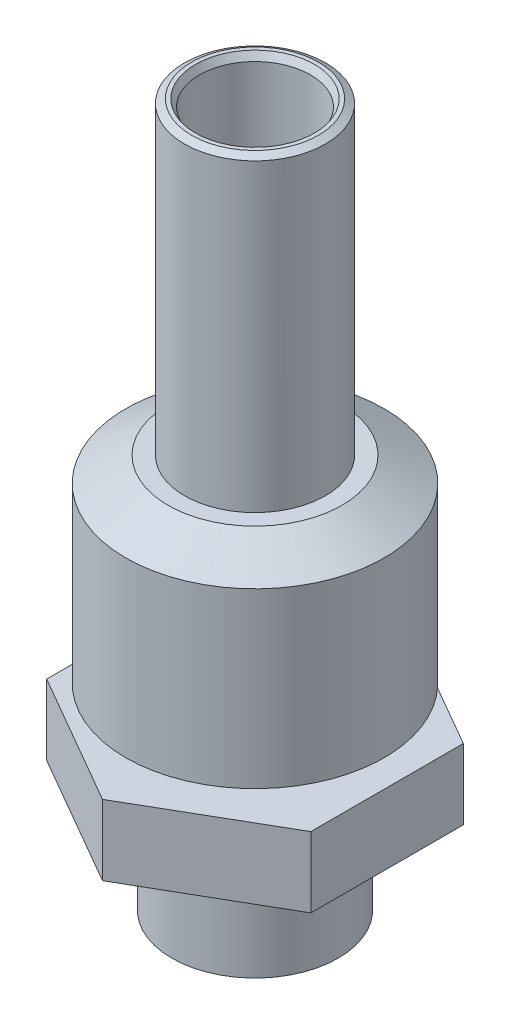
from build123d import *
from OCP.BRepFilletAPI import BRepFilletAPI_MakeChamfer

# Parameters (mm, degrees)
BOSS_EXTRUDE1_DEPTH = 27.432
CHAMFER1_SIZE       = 0.254
CHAMFER1_SIZE2      = 0.146646968


# Read off the part's stored shape, not the designer's step: Cut-Revolve4
with BuildPart() as part:
    # Sketch3 → Boss-Extrude1 (new body)
    with BuildSketch(Plane(origin=(0, 0, 0), x_dir=(1, 0, 0), z_dir=(0, 1, 0))):
        Polygon((4.7625, 2.749630657), (0, 5.499261314), (-4.7625, 2.749630657), (-4.7625, -2.749630657), (0, -5.499261314), (4.7625, -2.749630657), align=None)
    extrude(amount=BOSS_EXTRUDE1_DEPTH)

    # Cut-Revolve4 outline → Cut-Revolve4 (revolve, cut)
    with BuildSketch(Plane.XY):
        Polygon((4.6609, 9.18188181), (3.1369, 8.302), (5.499261314, 8.302), (5.499261314, 27.432), (2.54, 27.432), (2.54, 16.302), (3.1369, 16.302), (4.6609, 15.42211819), align=None)
        Polygon((0.99695, 21.082), (2, 21.082), (2, 27.432), (0, 27.432), (0, 1.391072642), (0.99695, 1.92116036), align=None)
    revolve(axis=Axis((0, 0, 0), (0, 1, 0)), mode=Mode.SUBTRACT)

    # Chamfer1: one chamfer whose edges measure the first distance from different faces: ONE call of the kernel's chamfer builder (chamfer() names one face for all edges)
    chamfer1_edges_1 = [part.edges().sort_by_distance(p)[0] for p in [
        (-2.54, 27.432, 0),
    ]]
    chamfer1_side_1 = [part.faces().sort_by_distance(p)[0] for p in [
        (-2.468157951, 27.432, 0),
    ]]
    chamfer1_edges_2 = [part.edges().sort_by_distance(p)[0] for p in [
        (-2, 27.432, 0),
    ]]
    chamfer1_side_2 = [part.faces().sort_by_distance(p)[0] for p in [
        (-2, 24.257, 0),
    ]]
    chamfer1 = BRepFilletAPI_MakeChamfer(part.part.solid().wrapped)
    for e in chamfer1_edges_1:
        chamfer1.Add(CHAMFER1_SIZE, CHAMFER1_SIZE2, e.wrapped, chamfer1_side_1[0].wrapped)  # the first distance lies on this face
    for e in chamfer1_edges_2:
        chamfer1.Add(CHAMFER1_SIZE, CHAMFER1_SIZE2, e.wrapped, chamfer1_side_2[0].wrapped)  # the first distance lies on this face
    add(Compound.cast(chamfer1.Shape()), mode=Mode.REPLACE)

    # Sketch4 → Cut-Revolve5 (revolve, cut)
    with BuildSketch(Plane.XY, mode=Mode.PRIVATE) as cut_revolve5_sk:
        Polygon((-0.35, 0.762), (-0.5, 0.762), (-3, 2.091273579), (-3, 5.762), (-6.107414125, 5.762), (-6.107414125, 0), (0, 0), (0, 1.524), (-0.35, 1.524), align=None)
    revolve(cut_revolve5_sk.sketch.rotate(Axis((0, 0, 0), (0, 1, 0)), 270), axis=Axis((0, 0, 0), (0, 1, 0)), mode=Mode.SUBTRACT)


solid = part.part
